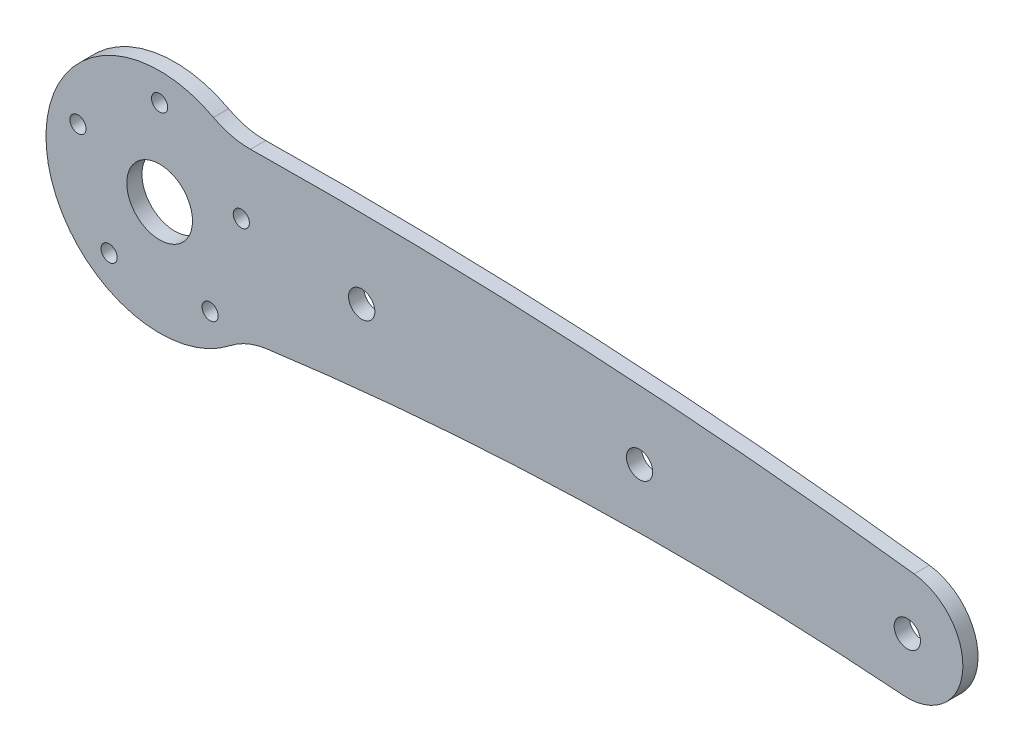
from build123d import *

# Parameters (mm, degrees)
BOSS_EXTRUDE1_START     = -5
BOSS_EXTRUDE1_OUTLINE_R = 1.925
BOSS_EXTRUDE1_DEPTH     = 5
SKETCH4_R               = 1.6
CUT_EXTRUDE2_DEPTH      = 161.661912101
FILLET1_R               = 15
SKETCH5_R               = 6.5
SKETCH5_R_2             = 2.6
CUT_EXTRUDE4_DEPTH      = 161.661912218
SKETCH6_W               = 233.09675901
SKETCH6_H               = 87.107773224
CUT_EXTRUDE5_DEPTH      = 2


with BuildPart() as part:
    # Boss-Extrude1: read off the stored shape, not the designer's step
    # Boss-Extrude1 outline → Boss-Extrude1 (new body)
    with BuildSketch(Plane.XY.offset(5).offset(BOSS_EXTRUDE1_START)):
        with BuildLine():
            ThreePointArc((149.353851183, 10.916367847), (81.584978704, 16.866619507), (13.564040933, 17.951790818))
            ThreePointArc((13.564040933, 17.951790818), (-22.408339146, -2.028875729), (16.567779435, -15.223622585))
            ThreePointArc((16.567779435, -15.223622585), (81.747231754, -9.530296146), (147.159069574, -10.96780908))
            ThreePointArc((147.159069574, -10.96780908), (158.945093507, -1.097692183), (149.353851183, 10.916367847))
        make_face()
        with Locations((40, 2.5)):
            Circle(BOSS_EXTRUDE1_OUTLINE_R, mode=Mode.SUBTRACT)
        with Locations((95, 2.5)):
            Circle(BOSS_EXTRUDE1_OUTLINE_R, mode=Mode.SUBTRACT)
    extrude(amount=BOSS_EXTRUDE1_DEPTH)

    # Sketch4 → Cut-Extrude2 (cut, through all)
    with BuildSketch(Plane.XY.offset(5)):
        with Locations((0, 17)):
            Circle(SKETCH4_R)
        with Locations((16.167960777, 5.253288904)):
            Circle(SKETCH4_R)
        with Locations((9.992349289, -13.753288904)):
            Circle(SKETCH4_R)
        with Locations((-9.992349289, -13.753288904)):
            Circle(SKETCH4_R)
        with Locations((-16.167960777, 5.253288904)):
            Circle(SKETCH4_R)
    extrude(amount=-CUT_EXTRUDE2_DEPTH, mode=Mode.SUBTRACT)

    # Fillet1
    fillet1_edges = [part.edges().sort_by_distance(p)[0] for p in [
        (16.567779435, -15.223622585, 2.5),
        (13.564040933, 17.951790818, 2.5),
    ]]
    fillet(fillet1_edges, radius=FILLET1_R)

    # Sketch5 → Cut-Extrude4 (cut, through all)
    with BuildSketch(Plane.XY.offset(5)):
        Circle(SKETCH5_R)
        with Locations((148, 0)):
            Circle(SKETCH5_R_2)
        with Locations((95, 2.5)):
            Circle(SKETCH5_R_2)
        with Locations((40, 2.5)):
            Circle(SKETCH5_R_2)
    extrude(amount=-CUT_EXTRUDE4_DEPTH, mode=Mode.SUBTRACT)

    # Sketch6 → Cut-Extrude5 (cut)
    with BuildSketch(Plane.XY.offset(5)):
        with Locations((68.481602645, 0)):
            Rectangle(SKETCH6_W, SKETCH6_H)
    extrude(amount=-CUT_EXTRUDE5_DEPTH, mode=Mode.SUBTRACT)


solid = part.part
